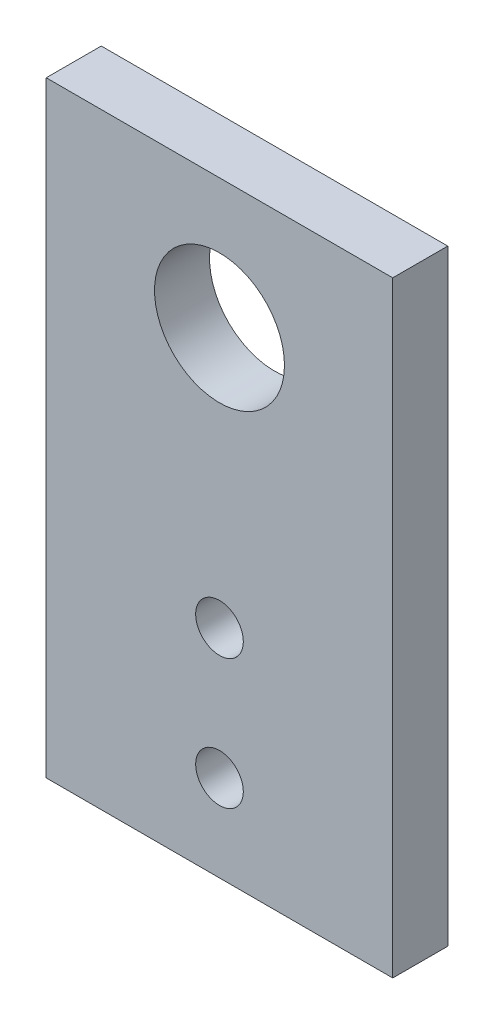
from build123d import *

# Parameters (mm, degrees)
SKETCH1_W            = 40
SKETCH1_H            = 70
SKETCH1_R            = 7.5
BOSS_EXTRUDE1_DEPTH  = 6.35
M5_CLEARANCE_HOLE1_D = 5.5


with BuildPart() as part:
    # Sketch1 → Boss-Extrude1 (new body)
    with BuildSketch(Plane.XY):
        Rectangle(SKETCH1_W, SKETCH1_H)
        with Locations((0, 20)):
            Circle(SKETCH1_R, mode=Mode.SUBTRACT)
    extrude(amount=BOSS_EXTRUDE1_DEPTH)

    # M5 Clearance Hole1 (through all)
    with Locations(Plane.XY.offset(6.35)):
        with Locations((0, -10), (0, -25)):
            Hole(M5_CLEARANCE_HOLE1_D / 2)


solid = part.part
